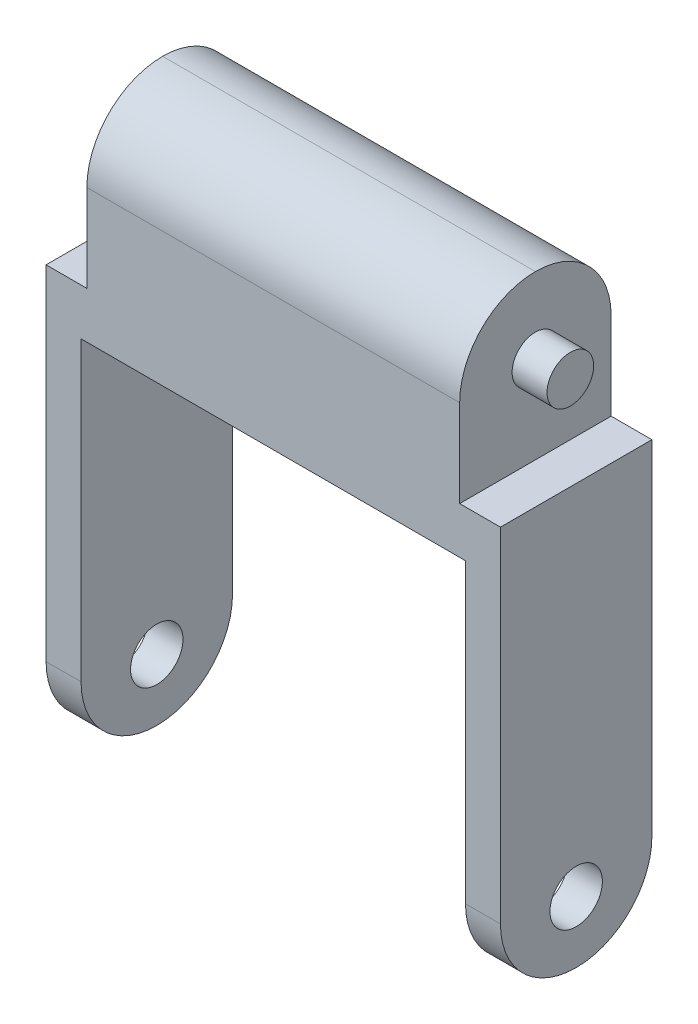
from build123d import *

# Parameters (mm, degrees)
BOSS_EXTRUDE1_DEPTH = 13
SKETCH2_R           = 2.25
CUT_EXTRUDE1_DEPTH  = 65.730209331
SKETCH3_R           = 2
BOSS_EXTRUDE2_DEPTH = 3
BOSS_EXTRUDE3_START = 3
SKETCH4_R           = 2
BOSS_EXTRUDE3_DEPTH = 3
FILLET1_R           = 6.5
FILLET2_R           = 6.5


with BuildPart() as part:
    # Sketch1 → Boss-Extrude1 (new body)
    with BuildSketch(Plane.XY):
        Polygon((3, 0), (3, 32), (36, 32), (36, 0), (39, 0), (39, 36), (35.5, 36), (35.5, 50), (3.5, 50), (3.5, 36), (0, 36), (0, 0), align=None)
    extrude(amount=BOSS_EXTRUDE1_DEPTH)

    # Sketch2 → Cut-Extrude1 (cut, through all)
    with BuildSketch(Plane.ZY):
        with Locations((6.5, 5.293988539)):
            Circle(SKETCH2_R)
    extrude(amount=-CUT_EXTRUDE1_DEPTH, mode=Mode.SUBTRACT)

    # Sketch3 → Boss-Extrude2 (add)
    with BuildSketch(Plane.ZY.offset(-3.5)):
        with Locations(Location((6.5, 43.5, 0), (0, 0, 180))):
            Circle(SKETCH3_R)
    extrude(amount=BOSS_EXTRUDE2_DEPTH)

    # Sketch4 → Boss-Extrude3 (add)
    with BuildSketch(Plane(origin=(35.5, 0, 0), x_dir=(0, 0, -1), z_dir=(1, 0, 0)).offset(BOSS_EXTRUDE3_START)):
        with Locations((-6.5, 43.5)):
            Circle(SKETCH4_R)
    extrude(amount=-BOSS_EXTRUDE3_DEPTH)

    # Fillet1
    fillet1_edges = [part.edges().sort_by_distance(p)[0] for p in [
        (1.5, 0, 0),
        (1.5, 0, 13),
        (37.5, 0, 0),
        (37.5, 0, 13),
    ]]
    fillet(fillet1_edges, radius=FILLET1_R - 0.0001)  # a hair under: the kernel refuses the full size

    # Fillet2
    fillet2_edges = [part.edges().sort_by_distance(p)[0] for p in [
        (19.5, 50, 13),
        (19.5, 50, 0),
    ]]
    fillet(fillet2_edges, radius=FILLET2_R - 0.0001)  # a hair under: the kernel refuses the full size


solid = part.part
